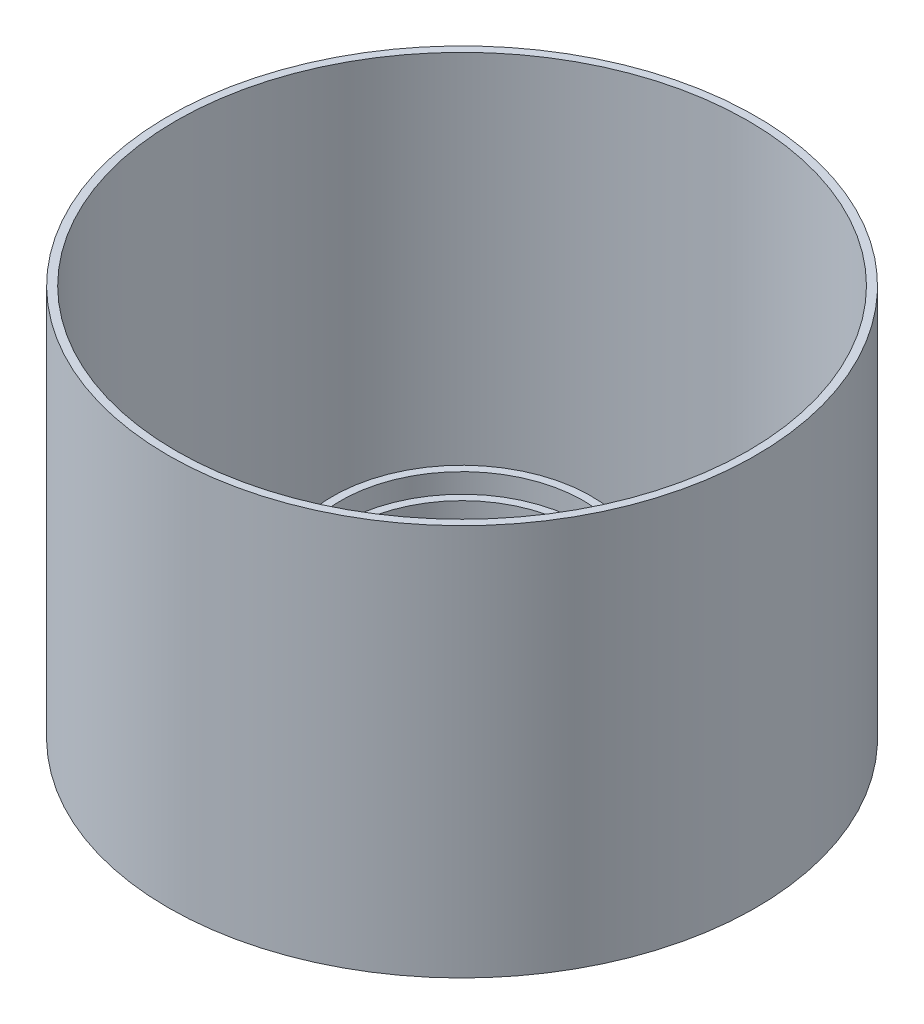
from build123d import *

# Parameters (mm, degrees)
SKETCH1_R           = 75
BOSS_EXTRUDE1_DEPTH = 100
SHELL1_T            = -2
SKETCH2_R           = 33
SKETCH2_R_2         = 29
EXTRUDE_THIN1_DEPTH = 35
SKETCH3_R           = 31
CUT_EXTRUDE1_DEPTH  = 5
CUT_EXTRUDE2_START  = -2
SKETCH4_R           = 29
CUT_EXTRUDE2_DEPTH  = 2


with BuildPart() as part:
    # Sketch1 → Boss-Extrude1 (new body)
    with BuildSketch(Plane(origin=(0, 0, 0), x_dir=(1, 0, 0), z_dir=(0, 1, 0))):
        Circle(SKETCH1_R)
    extrude(amount=BOSS_EXTRUDE1_DEPTH)

    # Shell1
    shell1_openings = [part.faces().sort_by_distance(p)[0] for p in [
        (0, 100, 0),
    ]]
    offset(amount=SHELL1_T, openings=shell1_openings, kind=Kind.INTERSECTION)

    # Sketch2 → Extrude-Thin1 (add)
    with BuildSketch(Plane(origin=(0, 2, 0), x_dir=(1, 0, 0), z_dir=(0, 1, 0))):
        Circle(SKETCH2_R)
        Circle(SKETCH2_R_2, mode=Mode.SUBTRACT)
    extrude(amount=EXTRUDE_THIN1_DEPTH)

    # Sketch3 → Cut-Extrude1 (cut)
    with BuildSketch(Plane(origin=(0, 37, 0), x_dir=(1, 0, 0), z_dir=(0, 1, 0))):
        Circle(SKETCH3_R)
    extrude(amount=-CUT_EXTRUDE1_DEPTH, mode=Mode.SUBTRACT)

    # Sketch4 → Cut-Extrude2 (cut)
    with BuildSketch(Plane(origin=(0, 2, 0), x_dir=(1, 0, 0), z_dir=(0, 1, 0)).offset(CUT_EXTRUDE2_START)):
        Circle(SKETCH4_R)
    extrude(amount=CUT_EXTRUDE2_DEPTH, mode=Mode.SUBTRACT)


solid = part.part
